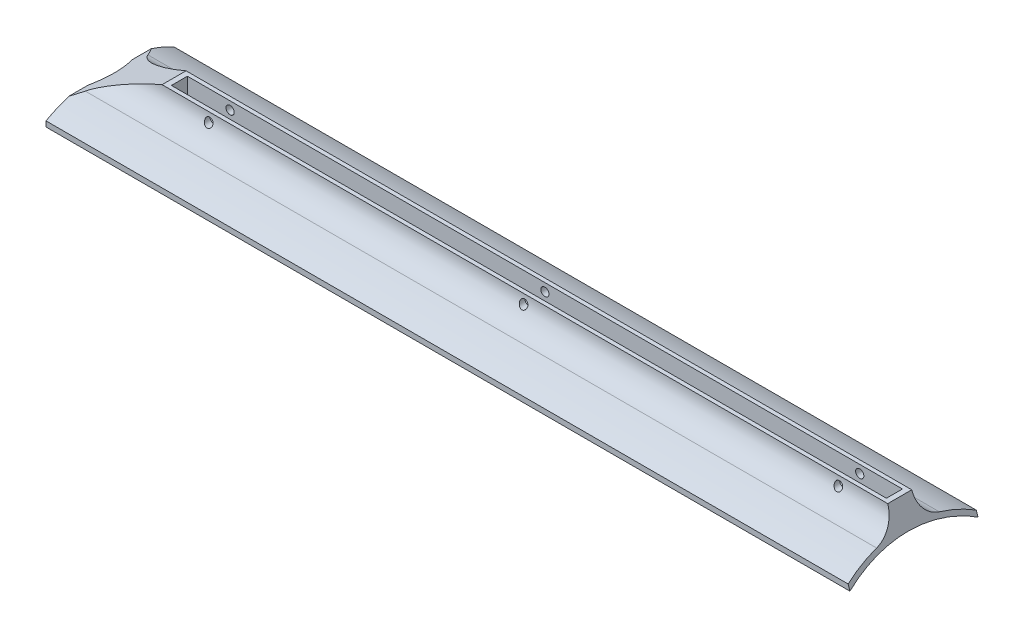
from build123d import *

# Parameters (mm, degrees)
BOSS_EXTRUDE1_DEPTH                 = 254
CUT_EXTRUDE1_DEPTH                  = 266.487720997
SKETCH3_W                           = 425.45
SKETCH3_H                           = 9.525
CUT_EXTRUDE2_DEPTH                  = 9.525
CUT_EXTRUDE3_REACH                  = 259.904
CUT_EXTRUDE3_END_RADIUS             = 15.089603758
SKETCH6_R                           = 2.4384
CUT_EXTRUDE3_DIRECTION_2_REACH      = 259.904
CUT_EXTRUDE3_DIRECTION_2_END_RADIUS = 15.089603758


with BuildPart() as part:
    # Sketch1 → Boss-Extrude1 (new, symmetric)
    with BuildSketch(Plane(origin=(0, 0, 0), x_dir=(0, 0, -1), z_dir=(1, 0, 0))):
        with BuildLine():
            Line((-38.1, -9.525), (-38.1, -12.7))
            ThreePointArc((-38.1, -12.7), (0, -2.491135768), (38.1, -12.7))
            Line((38.1, -12.7), (38.1, -9.525))
            ThreePointArc((38.1, -9.525), (28.631331147, -5.098940436), (18.661047774, -1.962199681))
            ThreePointArc((18.661047774, -1.962199681), (10.363087786, 3.375642683), (7.1374, 12.7))
            Line((7.1374, 12.7), (-7.1374, 12.7))
            ThreePointArc((-7.1374, 12.7), (-10.363087786, 3.375642683), (-18.661047774, -1.962199681))
            ThreePointArc((-18.661047774, -1.962199681), (-28.631331147, -5.098940436), (-38.1, -9.525))
        make_face()
    extrude(amount=BOSS_EXTRUDE1_DEPTH, both=True)

    # Sketch2 → Cut-Extrude1 (cut, through all)
    with BuildSketch(Plane.XY.offset(38.1)):
        Polygon((-254, 12.7), (-215.9, 12.7), (-254, -3.6322), align=None)
        Polygon((254, -12.7), (224.3582, -12.7), (215.9, 12.7), (254, 12.7), align=None)
    extrude(amount=-CUT_EXTRUDE1_DEPTH, mode=Mode.SUBTRACT)

    # Sketch3 → Cut-Extrude2 (cut)
    with BuildSketch(Plane(origin=(0, 12.7, 0), x_dir=(1, 0, 0), z_dir=(0, 1, 0))):
        Rectangle(SKETCH3_W, SKETCH3_H)
    extrude(amount=-CUT_EXTRUDE2_DEPTH, mode=Mode.SUBTRACT)

    # Cut-Extrude3: up to this cylinder (the profile starts outside it)
    cut_extrude3_end = Plane(origin=(0, 12.7, -22.227003758), z_dir=(-1, 0, 0)) * Cylinder(CUT_EXTRUDE3_END_RADIUS, 925.637207515, mode=Mode.PRIVATE)
    # Sketch6 → Cut-Extrude3 (cut, up to the surface)
    with BuildSketch(Plane.XY.offset(-4.7625), mode=Mode.PRIVATE) as cut_extrude3_sk1:
        with Locations((-187.325, 7.9375)):
            Circle(SKETCH6_R)
    cut_extrude3_tool1 = extrude(cut_extrude3_sk1.sketch, amount=-CUT_EXTRUDE3_REACH, mode=Mode.PRIVATE) - cut_extrude3_end
    add(cut_extrude3_tool1.solids().sort_by_distance((-187.325, 7.9375, -4.7625))[0], mode=Mode.SUBTRACT)
    # Sketch6 → Cut-Extrude3 (cut, up to the surface)
    with BuildSketch(Plane.XY.offset(-4.7625), mode=Mode.PRIVATE) as cut_extrude3_sk2:
        with Locations((187.325, 7.9375)):
            Circle(SKETCH6_R)
    cut_extrude3_tool2 = extrude(cut_extrude3_sk2.sketch, amount=-CUT_EXTRUDE3_REACH, mode=Mode.PRIVATE) - cut_extrude3_end
    add(cut_extrude3_tool2.solids().sort_by_distance((187.325, 7.9375, -4.7625))[0], mode=Mode.SUBTRACT)
    # Sketch6 → Cut-Extrude3 (cut, up to the surface)
    with BuildSketch(Plane.XY.offset(-4.7625), mode=Mode.PRIVATE) as cut_extrude3_sk3:
        with Locations((0, 7.9375)):
            Circle(SKETCH6_R)
    cut_extrude3_tool3 = extrude(cut_extrude3_sk3.sketch, amount=-CUT_EXTRUDE3_REACH, mode=Mode.PRIVATE) - cut_extrude3_end
    add(cut_extrude3_tool3.solids().sort_by_distance((0, 7.9375, -4.7625))[0], mode=Mode.SUBTRACT)

    # Cut-Extrude3 direction 2: up to this cylinder (the profile starts outside it)
    cut_extrude3_direction_2_end = Plane(origin=(0, 12.7, 22.227003758), z_dir=(-1, 0, 0)) * Cylinder(CUT_EXTRUDE3_DIRECTION_2_END_RADIUS, 925.637207515, mode=Mode.PRIVATE)
    # Sketch6 → Cut-Extrude3 direction 2 (cut, up to the surface)
    with BuildSketch(Plane.XY.offset(-4.7625), mode=Mode.PRIVATE) as cut_extrude3_direction_2_sk1:
        with Locations((-187.325, 7.9375)):
            Circle(SKETCH6_R)
    cut_extrude3_direction_2_tool1 = extrude(cut_extrude3_direction_2_sk1.sketch, amount=CUT_EXTRUDE3_DIRECTION_2_REACH, mode=Mode.PRIVATE) - cut_extrude3_direction_2_end
    add(cut_extrude3_direction_2_tool1.solids().sort_by_distance((-187.325, 7.9375, -4.7625))[0], mode=Mode.SUBTRACT)
    # Sketch6 → Cut-Extrude3 direction 2 (cut, up to the surface)
    with BuildSketch(Plane.XY.offset(-4.7625), mode=Mode.PRIVATE) as cut_extrude3_direction_2_sk2:
        with Locations((187.325, 7.9375)):
            Circle(SKETCH6_R)
    cut_extrude3_direction_2_tool2 = extrude(cut_extrude3_direction_2_sk2.sketch, amount=CUT_EXTRUDE3_DIRECTION_2_REACH, mode=Mode.PRIVATE) - cut_extrude3_direction_2_end
    add(cut_extrude3_direction_2_tool2.solids().sort_by_distance((187.325, 7.9375, -4.7625))[0], mode=Mode.SUBTRACT)
    # Sketch6 → Cut-Extrude3 direction 2 (cut, up to the surface)
    with BuildSketch(Plane.XY.offset(-4.7625), mode=Mode.PRIVATE) as cut_extrude3_direction_2_sk3:
        with Locations((0, 7.9375)):
            Circle(SKETCH6_R)
    cut_extrude3_direction_2_tool3 = extrude(cut_extrude3_direction_2_sk3.sketch, amount=CUT_EXTRUDE3_DIRECTION_2_REACH, mode=Mode.PRIVATE) - cut_extrude3_direction_2_end
    add(cut_extrude3_direction_2_tool3.solids().sort_by_distance((0, 7.9375, -4.7625))[0], mode=Mode.SUBTRACT)


solid = part.part
